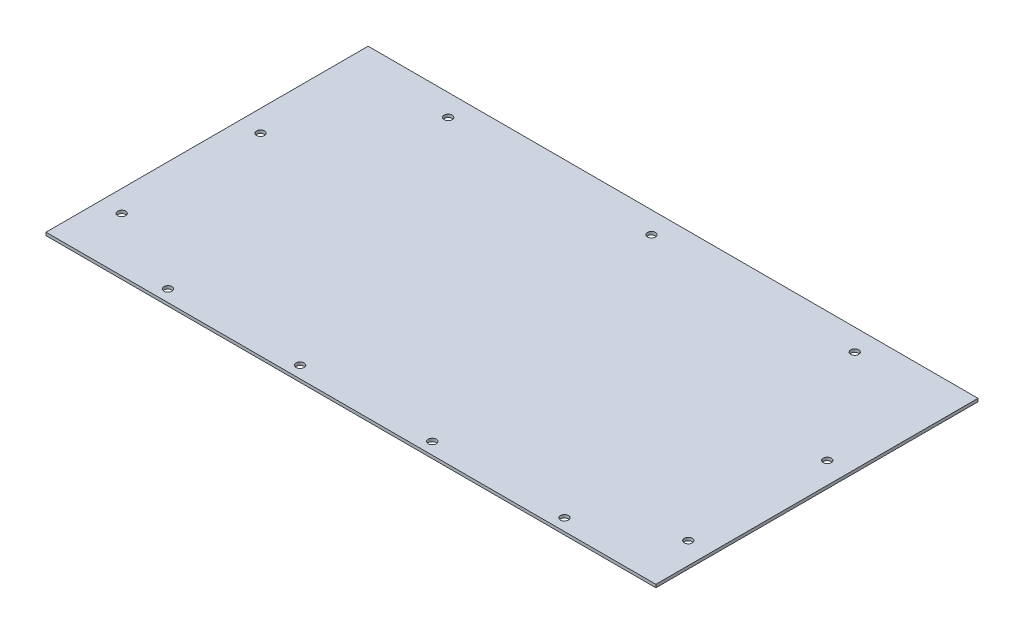
from build123d import *

# Parameters (mm, degrees)
SKETCH1_W           = 457.2
SKETCH1_H           = 2.286
BOSS_EXTRUDE1_DEPTH = 238.315200026
SKETCH2_W           = 457.2
SKETCH2_H           = 2.286
BOSS_EXTRUDE2_DEPTH = 3.175
SKETCH8_R           = 3
CUT_EXTRUDE9_DEPTH  = 3.175
SKETCH9_R           = 3
CUT_EXTRUDE10_DEPTH = 2.54
LPATTERN1_COUNT     = 4
LPATTERN1_PITCH     = 99.06


with BuildPart() as part:
    # Sketch1 → Boss-Extrude1 (new body)
    with BuildSketch(Plane.XY):
        Rectangle(SKETCH1_W, SKETCH1_H)
    extrude(amount=BOSS_EXTRUDE1_DEPTH)

    # Sketch2 → Boss-Extrude2 (add)
    with BuildSketch(Plane(origin=(0, 0, 0), x_dir=(-1, 0, 0), z_dir=(0, 0, -1))):
        Rectangle(SKETCH2_W, SKETCH2_H)
    extrude(amount=BOSS_EXTRUDE2_DEPTH)

    # Sketch8 → Cut-Extrude9 (cut)
    with BuildSketch(Plane.XZ.offset(1.143)):
        with Locations((-212.419, 197.784793717)):
            Circle(SKETCH8_R)
        with Locations((-212.419, 93.644793717)):
            Circle(SKETCH8_R)
        with Locations((-152.4, 13.0175)):
            Circle(SKETCH8_R)
        with Locations((0, 13.0175)):
            Circle(SKETCH8_R)
        with Locations((152.4, 13.0175)):
            Circle(SKETCH8_R)
        with Locations((212.419, 197.784793717)):
            Circle(SKETCH8_R)
        with Locations((212.419, 93.644793717)):
            Circle(SKETCH8_R)
    extrude(amount=-CUT_EXTRUDE9_DEPTH, mode=Mode.SUBTRACT)

    # Sketch9 → Cut-Extrude10 (cut)
    with BuildSketch(Plane(origin=(0, 1.143, 0), x_dir=(1, 0, 0), z_dir=(0, 1, 0))):
        with Locations((-146.05, -229.425200026)):
            Circle(SKETCH9_R)
    cut_extrude10 = extrude(amount=-CUT_EXTRUDE10_DEPTH, mode=Mode.SUBTRACT)

    # LPattern1: Cut-Extrude10 ×4
    with Locations(*[(i * LPATTERN1_PITCH, 0, 0) for i in range(1, LPATTERN1_COUNT)]):
        add(cut_extrude10, mode=Mode.SUBTRACT)


solid = part.part
